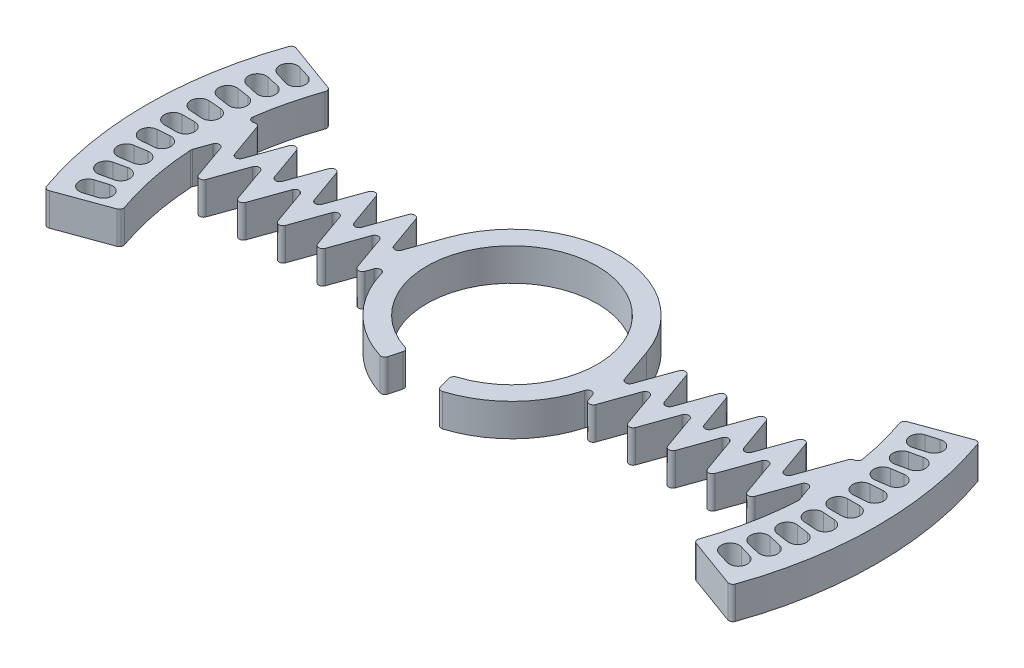
from build123d import *

# Parameters (mm, degrees)
EXTRUDE_1_DEPTH     = 8
CUT_EXTRUDE_1_DEPTH = 96.454282279
FILLET_7_R          = 1
FILLET_8_R          = 1
FILLET_9_R          = 1
FILLET_10_R         = 1


with BuildPart() as part:
    # 草图1 → 凸台-拉伸1 (new body)
    with BuildSketch(Plane(origin=(0, 0, 0), x_dir=(1, 0, 0), z_dir=(0, 1, 0))):
        with BuildLine():
            Line((5.435199947, -20.284442352), (6.729295173, -25.114071484))
            ThreePointArc((6.729295173, -25.114071484), (19.436940758, -17.268622817), (25.731680539, -3.725669956))
            Line((25.731680539, -3.725669956), (28.45, -11.377675219))
            Line((28.45, -11.377675219), (33.35, 2.415709381))
            Line((33.35, 2.415709381), (38.25, -11.377675219))
            Line((38.25, -11.377675219), (43.15, 2.415709381))
            Line((43.15, 2.415709381), (48.05, -11.377675219))
            Line((48.05, -11.377675219), (52.95, 2.415709381))
            Line((52.95, 2.415709381), (57.85, -11.377675219))
            Line((57.85, -11.377675219), (62.75, 2.415709381))
            Line((62.75, 2.415709381), (67.65, -11.377675219))
            Line((67.65, -11.377675219), (72.55, 2.415709381))
            Line((72.55, 2.415709381), (74.884734133, -4.156512218))
            ThreePointArc((74.884734133, -4.156512218), (73.471173217, -15.066077994), (70.476946559, -25.651510749))
            Line((70.476946559, -25.651510749), (84.572335871, -30.781812899))
            ThreePointArc((84.572335871, -30.781812899), (90, 0), (84.572335871, 30.781812899))
            Line((84.572335871, 30.781812899), (70.476946559, 25.651510749))
            ThreePointArc((70.476946559, 25.651510749), (73.391397838, 15.450007228), (74.837176992, 4.939325852))
            Line((74.837176992, 4.939325852), (72.55, 11.377675219))
            Line((72.55, 11.377675219), (67.65, -2.415709381))
            Line((67.65, -2.415709381), (62.75, 11.377675219))
            Line((62.75, 11.377675219), (57.85, -2.415709381))
            Line((57.85, -2.415709381), (52.95, 11.377675219))
            Line((52.95, 11.377675219), (48.05, -2.415709381))
            Line((48.05, -2.415709381), (43.15, 11.377675219))
            Line((43.15, 11.377675219), (38.25, -2.415709381))
            Line((38.25, -2.415709381), (33.35, 11.377675219))
            Line((33.35, 11.377675219), (28.45, -2.415709381))
            Line((28.45, -2.415709381), (24.5, 8.703447593))
            ThreePointArc((24.5, 8.703447593), (0, 26), (-24.5, 8.703447593))
            Line((-24.5, 8.703447593), (-28.45, -2.415709381))
            Line((-28.45, -2.415709381), (-33.35, 11.377675219))
            Line((-33.35, 11.377675219), (-38.25, -2.415709381))
            Line((-38.25, -2.415709381), (-43.15, 11.377675219))
            Line((-43.15, 11.377675219), (-48.05, -2.415709381))
            Line((-48.05, -2.415709381), (-52.95, 11.377675219))
            Line((-52.95, 11.377675219), (-57.85, -2.415709381))
            Line((-57.85, -2.415709381), (-62.75, 11.377675219))
            Line((-62.75, 11.377675219), (-67.65, -2.415709381))
            Line((-67.65, -2.415709381), (-72.55, 11.377675219))
            Line((-72.55, 11.377675219), (-74.837176992, 4.939325852))
            ThreePointArc((-74.837176992, 4.939325852), (-73.391397838, 15.450007228), (-70.476946559, 25.651510749))
            Line((-70.476946559, 25.651510749), (-84.572335871, 30.781812899))
            ThreePointArc((-84.572335871, 30.781812899), (-90, 0), (-84.572335871, -30.781812899))
            Line((-84.572335871, -30.781812899), (-70.476946559, -25.651510749))
            ThreePointArc((-70.476946559, -25.651510749), (-73.471173217, -15.066077994), (-74.884734133, -4.156512218))
            Line((-74.884734133, -4.156512218), (-72.55, 2.415709381))
            Line((-72.55, 2.415709381), (-67.65, -11.377675219))
            Line((-67.65, -11.377675219), (-62.75, 2.415709381))
            Line((-62.75, 2.415709381), (-57.85, -11.377675219))
            Line((-57.85, -11.377675219), (-52.95, 2.415709381))
            Line((-52.95, 2.415709381), (-48.05, -11.377675219))
            Line((-48.05, -11.377675219), (-43.15, 2.415709381))
            Line((-43.15, 2.415709381), (-38.25, -11.377675219))
            Line((-38.25, -11.377675219), (-33.35, 2.415709381))
            Line((-33.35, 2.415709381), (-28.45, -11.377675219))
            Line((-28.45, -11.377675219), (-25.731680539, -3.725669956))
            ThreePointArc((-25.731680539, -3.725669956), (-19.436940758, -17.268622817), (-6.729295173, -25.114071484))
            Line((-6.729295173, -25.114071484), (-5.435199947, -20.284442352))
            ThreePointArc((-5.435199947, -20.284442352), (0, 21), (5.435199947, -20.284442352))
        make_face()
    extrude(amount=EXTRUDE_1_DEPTH)

    # 草图2 → 切除-拉伸1 (cut, through all)
    with BuildSketch(Plane(origin=(0, 8, 0), x_dir=(1, 0, 0), z_dir=(0, 1, 0))):
        with BuildLine():
            Line((-83.5, -2.2), (-80.5, -2.2))
            ThreePointArc((-80.5, -2.2), (-78.3, 0), (-80.5, 2.2))
            Line((-80.5, 2.2), (-83.5, 2.2))
            ThreePointArc((-83.5, 2.2), (-85.7, 0), (-83.5, -2.2))
        make_face()
        with BuildLine():
            Line((83.5, 2.2), (80.5, 2.2))
            ThreePointArc((80.5, 2.2), (78.3, 0), (80.5, -2.2))
            Line((80.5, -2.2), (83.5, -2.2))
            ThreePointArc((83.5, -2.2), (85.7, 0), (83.5, 2.2))
        make_face()
        with BuildLine():
            Line((-83.429911848, 4.066916396), (-80.438356448, 3.841980216))
            ThreePointArc((-80.438356448, 3.841980216), (-78.079595955, 5.870834311), (-80.10845005, 8.229594803))
            Line((-80.10845005, 8.229594803), (-83.10000545, 8.454530984))
            ThreePointArc((-83.10000545, 8.454530984), (-85.458765943, 6.425676889), (-83.429911848, 4.066916396))
        make_face()
        with BuildLine():
            Line((-82.890135573, 10.310937139), (-79.92386643, 9.862331109))
            ThreePointArc((-79.92386643, 9.862331109), (-77.419624636, 11.708617392), (-79.265910919, 14.212859186))
            Line((-79.265910919, 14.212859186), (-82.232180062, 14.661465216))
            ThreePointArc((-82.232180062, 14.661465216), (-84.736421856, 12.815178933), (-82.890135573, 10.310937139))
        make_face()
        with BuildLine():
            Line((-81.88370997, 16.49691006), (-78.959426388, 15.827159712))
            ThreePointArc((-78.959426388, 15.827159712), (-76.323801505, 17.480484084), (-77.977125877, 20.116108966))
            Line((-77.977125877, 20.116108966), (-80.90140946, 20.785859314))
            ThreePointArc((-80.90140946, 20.785859314), (-83.537034342, 19.132534942), (-81.88370997, 16.49691006))
        make_face()
        with BuildLine():
            Line((-80.416300947, 22.590009782), (-77.550465861, 21.702885632))
            ThreePointArc((-77.550465861, 21.702885632), (-74.798295754, 23.153940318), (-76.249350441, 25.906110425))
            Line((-76.249350441, 25.906110425), (-79.115185527, 26.793234575))
            ThreePointArc((-79.115185527, 26.793234575), (-81.867355634, 25.342179889), (-80.416300947, 22.590009782))
        make_face()
        with BuildLine():
            Line((-83.10000545, -8.454530984), (-80.10845005, -8.229594803))
            ThreePointArc((-80.10845005, -8.229594803), (-78.079595955, -5.870834311), (-80.438356448, -3.841980216))
            Line((-80.438356448, -3.841980216), (-83.429911848, -4.066916396))
            ThreePointArc((-83.429911848, -4.066916396), (-85.458765943, -6.425676889), (-83.10000545, -8.454530984))
        make_face()
        with BuildLine():
            Line((-82.232180062, -14.661465216), (-79.265910919, -14.212859186))
            ThreePointArc((-79.265910919, -14.212859186), (-77.419624636, -11.708617392), (-79.92386643, -9.862331109))
            Line((-79.92386643, -9.862331109), (-82.890135573, -10.310937139))
            ThreePointArc((-82.890135573, -10.310937139), (-84.736421856, -12.815178933), (-82.232180062, -14.661465216))
        make_face()
        with BuildLine():
            Line((-80.90140946, -20.785859314), (-77.977125877, -20.116108966))
            ThreePointArc((-77.977125877, -20.116108966), (-76.323801505, -17.480484084), (-78.959426388, -15.827159712))
            Line((-78.959426388, -15.827159712), (-81.88370997, -16.49691006))
            ThreePointArc((-81.88370997, -16.49691006), (-83.537034342, -19.132534942), (-80.90140946, -20.785859314))
        make_face()
        with BuildLine():
            Line((-79.115185527, -26.793234575), (-76.249350441, -25.906110425))
            ThreePointArc((-76.249350441, -25.906110425), (-74.798295754, -23.153940318), (-77.550465861, -21.702885632))
            Line((-77.550465861, -21.702885632), (-80.416300947, -22.590009782))
            ThreePointArc((-80.416300947, -22.590009782), (-81.867355634, -25.342179889), (-79.115185527, -26.793234575))
        make_face()
        with BuildLine():
            Line((83.114634815, -8.30948131), (80.122691383, -8.089766719))
            ThreePointArc((80.122691383, -8.089766719), (78.089723567, -5.734550835), (80.44493945, -3.701583019))
            Line((80.44493945, -3.701583019), (83.436882882, -3.92129761))
            ThreePointArc((83.436882882, -3.92129761), (85.469850698, -6.276513494), (83.114634815, -8.30948131))
        make_face()
        with BuildLine():
            Line((82.28285714, -14.374332017), (79.315040141, -13.936082932))
            ThreePointArc((79.315040141, -13.936082932), (77.460023671, -11.438301136), (79.957805466, -9.583284667))
            Line((79.957805466, -9.583284667), (82.925622465, -10.021533752))
            ThreePointArc((82.925622465, -10.021533752), (84.780638935, -12.519315548), (82.28285714, -14.374332017))
        make_face()
        with BuildLine():
            Line((81.009134491, -20.361977533), (78.081384205, -19.707547809))
            ThreePointArc((78.081384205, -19.707547809), (76.41428246, -17.080615801), (79.041214467, -15.413514056))
            Line((79.041214467, -15.413514056), (81.968964753, -16.06794378))
            ThreePointArc((81.968964753, -16.06794378), (83.636066498, -18.694875788), (81.009134491, -20.361977533))
        make_face()
        with BuildLine():
            Line((79.300308091, -26.240257939), (76.428349598, -25.373162549))
            ThreePointArc((76.428349598, -25.373162549), (74.958116657, -22.631189701), (77.700089505, -21.160956759))
            Line((77.700089505, -21.160956759), (80.572047997, -22.02805215))
            ThreePointArc((80.572047997, -22.02805215), (82.042280938, -24.770024998), (79.300308091, -26.240257939))
        make_face()
        with BuildLine():
            Line((83.436882882, 3.92129761), (80.44493945, 3.701583019))
            ThreePointArc((80.44493945, 3.701583019), (78.089723567, 5.734550835), (80.122691383, 8.089766719))
            Line((80.122691383, 8.089766719), (83.114634815, 8.30948131))
            ThreePointArc((83.114634815, 8.30948131), (85.469850698, 6.276513494), (83.436882882, 3.92129761))
        make_face()
        with BuildLine():
            Line((82.925622465, 10.021533752), (79.957805466, 9.583284667))
            ThreePointArc((79.957805466, 9.583284667), (77.460023671, 11.438301136), (79.315040141, 13.936082932))
            Line((79.315040141, 13.936082932), (82.28285714, 14.374332017))
            ThreePointArc((82.28285714, 14.374332017), (84.780638935, 12.519315548), (82.925622465, 10.021533752))
        make_face()
        with BuildLine():
            Line((81.968964753, 16.06794378), (79.041214467, 15.413514056))
            ThreePointArc((79.041214467, 15.413514056), (76.41428246, 17.080615801), (78.081384205, 19.707547809))
            Line((78.081384205, 19.707547809), (81.009134491, 20.361977533))
            ThreePointArc((81.009134491, 20.361977533), (83.636066498, 18.694875788), (81.968964753, 16.06794378))
        make_face()
        with BuildLine():
            Line((80.572047997, 22.02805215), (77.700089505, 21.160956759))
            ThreePointArc((77.700089505, 21.160956759), (74.958116657, 22.631189701), (76.428349598, 25.373162549))
            Line((76.428349598, 25.373162549), (79.300308091, 26.240257939))
            ThreePointArc((79.300308091, 26.240257939), (82.042280938, 24.770024998), (80.572047997, 22.02805215))
        make_face()
    extrude(amount=-CUT_EXTRUDE_1_DEPTH, mode=Mode.SUBTRACT)

    # 圆角7
    fillet_7_edges = [part.edges().sort_by_distance(p)[0] for p in [
        (-28.45, 4, 11.377675219),
    ]]
    fillet(fillet_7_edges, radius=FILLET_7_R)

    # 圆角8
    # the kernel refuses this fillet: 1 mm, written as the material it adds along each edge
    with BuildSketch(Plane(origin=(74.837176992, 0, -4.939325852), x_dir=(-0.1160739333524306, 0, -0.9932405760922655), z_dir=(0, 1, 0))) as fillet_8_piece_1:
        with BuildLine():
            CenterArc((7.511003857, 0.998728637), FILLET_8_R, 148.287057897, 124.60241385)
            Line((6.660311465, 1.524392458), (0, 0))
            ThreePointArc((0, 0), (3.78070664, -0.095352232), (7.561413279, 0))
        make_face()
    extrude(amount=8)

    # 圆角9
    fillet_9_edges = [part.edges().sort_by_distance(p)[0] for p in [
        (-70.476946559, 4, -25.651510749),
        (-72.55, 4, -11.377675219),
        (-67.65, 4, 2.415709381),
        (-62.75, 4, -11.377675219),
        (-57.85, 4, 2.415709381),
        (-52.95, 4, -11.377675219),
        (-48.05, 4, 2.415709381),
        (-43.15, 4, -11.377675219),
        (-38.25, 4, 2.415709381),
        (-33.35, 4, -11.377675219),
        (-28.45, 4, 2.415709381),
        (28.45, 4, 2.415709381),
        (33.35, 4, -11.377675219),
        (38.25, 4, 2.415709381),
        (43.15, 4, -11.377675219),
        (48.05, 4, 2.415709381),
        (52.95, 4, -11.377675219),
        (57.85, 4, 2.415709381),
        (62.75, 4, -11.377675219),
        (67.65, 4, 2.415709381),
        (72.55, 4, -11.377675219),
        (70.476946559, 4, -25.651510749),
        (84.572335871, 4, -30.781812899),
        (84.572335871, 4, 30.781812899),
        (70.476946559, 4, 25.651510749),
        (74.884734133, 4, 4.156512218),
        (72.55, 4, -2.415709381),
        (67.65, 4, 11.377675219),
        (62.75, 4, -2.415709381),
    ]]
    fillet(fillet_9_edges, radius=FILLET_9_R)

    # 圆角10
    fillet_10_edges = [part.edges().sort_by_distance(p)[0] for p in [
        (-74.837176992, 4, -4.939325852),
        (-33.35, 4, -2.415709381),
        (-38.25, 4, 11.377675219),
        (-43.15, 4, -2.415709381),
        (-48.05, 4, 11.377675219),
        (-6.729295173, 4, 25.114071484),
        (5.435199947, 4, 20.284442352),
        (-5.435199947, 4, 20.284442352),
        (6.729295173, 4, 25.114071484),
        (-25.731680539, 4, 3.725669956),
        (-70.476946559, 4, 25.651510749),
        (-84.572335871, 4, 30.781812899),
        (-52.95, 4, -2.415709381),
        (-57.85, 4, 11.377675219),
        (-62.75, 4, -2.415709381),
        (-67.65, 4, 11.377675219),
        (-72.55, 4, -2.415709381),
        (-74.884734133, 4, 4.156512218),
        (57.85, 4, 11.377675219),
        (52.95, 4, -2.415709381),
        (48.05, 4, 11.377675219),
        (43.15, 4, -2.415709381),
        (38.25, 4, 11.377675219),
        (33.35, 4, -2.415709381),
        (28.45, 4, 11.377675219),
        (25.731680539, 4, 3.725669956),
        (-84.572335871, 4, -30.781812899),
    ]]
    fillet(fillet_10_edges, radius=FILLET_10_R)


solid = part.part
